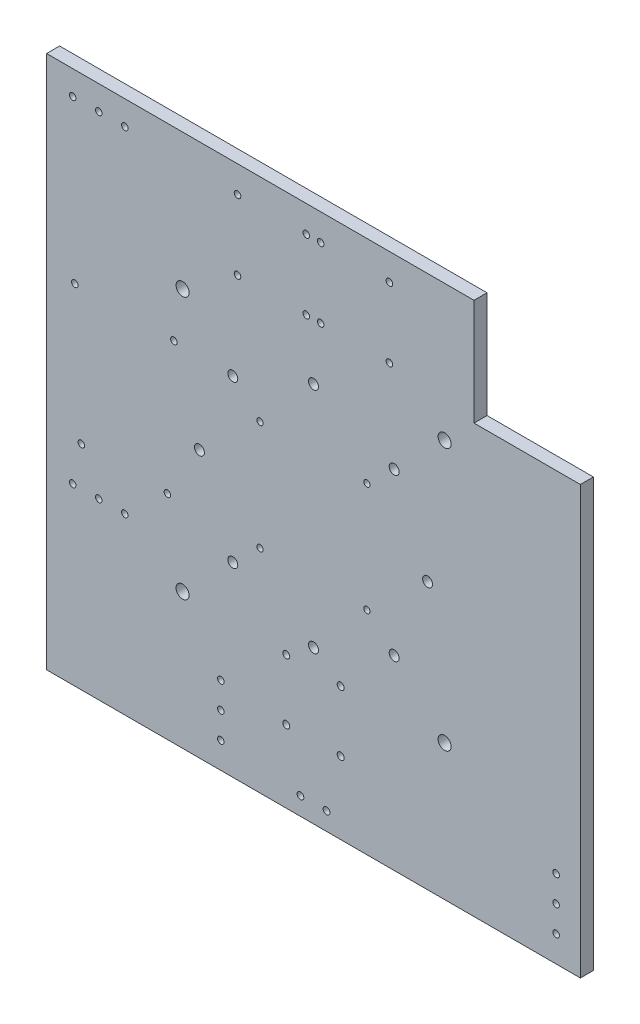
from build123d import *

# Parameters (mm, degrees)
SKETCH1_W           = 260
SKETCH1_H           = 260
SKETCH1_R           = 1.55
SKETCH1_R_2         = 1.5875
SKETCH1_R_3         = 1.6
SKETCH1_R_4         = 1.7
SKETCH1_R_5         = 2.415
SKETCH1_R_6         = 1.651
BOSS_EXTRUDE2_DEPTH = 6.35
SKETCH5_W           = 52.8
SKETCH5_H           = 52.8
CUT_EXTRUDE1_DEPTH  = 184.957393165
SKETCH6_R           = 3.175
CUT_EXTRUDE2_DEPTH  = 184.957393165
SKETCH7_R           = 1.5875
CUT_EXTRUDE3_DEPTH  = 184.957393165


with BuildPart() as part:
    # Sketch1 → Boss-Extrude2 (new body)
    with BuildSketch(Plane.XY):
        Rectangle(SKETCH1_W, SKETCH1_H)
        with Locations((-26.035, 26.67)):
            Circle(SKETCH1_R, mode=Mode.SUBTRACT)
        with Locations((-26.035, -26.67)):
            Circle(SKETCH1_R, mode=Mode.SUBTRACT)
        with Locations((26.035, 26.67)):
            Circle(SKETCH1_R, mode=Mode.SUBTRACT)
        with Locations((26.035, -26.67)):
            Circle(SKETCH1_R, mode=Mode.SUBTRACT)
        with Locations((-116.252739473, 39.816515681)):
            Circle(SKETCH1_R_2, mode=Mode.SUBTRACT)
        with Locations((-113.077739473, -26.221381917)):
            Circle(SKETCH1_R_2, mode=Mode.SUBTRACT)
        with Locations((-67.992739473, 39.818618083)):
            Circle(SKETCH1_R_2, mode=Mode.SUBTRACT)
        with Locations((-37, 117)):
            Circle(SKETCH1_R_3, mode=Mode.SUBTRACT)
        with Locations((-37, 83)):
            Circle(SKETCH1_R_3, mode=Mode.SUBTRACT)
        with Locations((-3.5, 117)):
            Circle(SKETCH1_R_3, mode=Mode.SUBTRACT)
        with Locations((-3.5, 83)):
            Circle(SKETCH1_R_3, mode=Mode.SUBTRACT)
        with Locations((3.5, 117)):
            Circle(SKETCH1_R_3, mode=Mode.SUBTRACT)
        with Locations((37, 117)):
            Circle(SKETCH1_R_3, mode=Mode.SUBTRACT)
        with Locations((37, 83)):
            Circle(SKETCH1_R_3, mode=Mode.SUBTRACT)
        with Locations((3.5, 83)):
            Circle(SKETCH1_R_3, mode=Mode.SUBTRACT)
        with Locations((-13.25, -65.25)):
            Circle(SKETCH1_R_4, mode=Mode.SUBTRACT)
        with Locations((13.25, -65.25)):
            Circle(SKETCH1_R_4, mode=Mode.SUBTRACT)
        with Locations((13.25, -94.75)):
            Circle(SKETCH1_R_4, mode=Mode.SUBTRACT)
        with Locations((-13.25, -94.75)):
            Circle(SKETCH1_R_4, mode=Mode.SUBTRACT)
        with Locations((0, 55.575)):
            Circle(SKETCH1_R_5, mode=Mode.SUBTRACT)
        with Locations((-55.575, 0)):
            Circle(SKETCH1_R_5, mode=Mode.SUBTRACT)
        with Locations((0, -55.575)):
            Circle(SKETCH1_R_5, mode=Mode.SUBTRACT)
        with Locations((55.575, 0)):
            Circle(SKETCH1_R_5, mode=Mode.SUBTRACT)
        with Locations((-39.297459364, 39.297459364)):
            Circle(SKETCH1_R_5, mode=Mode.SUBTRACT)
        with Locations((39.297459364, 39.297459364)):
            Circle(SKETCH1_R_5, mode=Mode.SUBTRACT)
        with Locations((39.297459364, -39.297459364)):
            Circle(SKETCH1_R_5, mode=Mode.SUBTRACT)
        with Locations((-39.297459364, -39.297459364)):
            Circle(SKETCH1_R_5, mode=Mode.SUBTRACT)
        with Locations((-71.167739473, -26.221381917)):
            Circle(SKETCH1_R_2, mode=Mode.SUBTRACT)
        with Locations((6.35, -121.3)):
            Circle(SKETCH1_R_6, mode=Mode.SUBTRACT)
        with Locations((-6.35, -121.3)):
            Circle(SKETCH1_R_6, mode=Mode.SUBTRACT)
        with Locations((121.3, 126.35)):
            Circle(SKETCH1_R_6, mode=Mode.SUBTRACT)
        with Locations((121.3, 113.65)):
            Circle(SKETCH1_R_6, mode=Mode.SUBTRACT)
    extrude(amount=BOSS_EXTRUDE2_DEPTH)

    # Sketch5 → Cut-Extrude1 (cut, through all)
    with BuildSketch(Plane(origin=(0, 0, 0), x_dir=(-1, 0, 0), z_dir=(0, 0, -1))):
        with Locations((-104.6, 104.6)):
            Rectangle(SKETCH5_W, SKETCH5_H)
    extrude(amount=-CUT_EXTRUDE1_DEPTH, mode=Mode.SUBTRACT)

    # Sketch6 → Cut-Extrude2 (cut, through all)
    with BuildSketch(Plane(origin=(0, 0, 0), x_dir=(-1, 0, 0), z_dir=(0, 0, -1))):
        with Locations((63.77864005, 63.77864005)):
            Circle(SKETCH6_R)
        with Locations((-63.87464005, 63.77864005)):
            Circle(SKETCH6_R)
        with Locations((-63.87464005, -63.87464005)):
            Circle(SKETCH6_R)
        with Locations((63.77864005, -63.87464005)):
            Circle(SKETCH6_R)
    extrude(amount=-CUT_EXTRUDE2_DEPTH, mode=Mode.SUBTRACT)

    # Sketch7 → Cut-Extrude3 (cut, through all)
    with BuildSketch(Plane(origin=(0, 0, 0), x_dir=(-1, 0, 0), z_dir=(0, 0, -1))):
        with Locations((91.9, 118.189)):
            Circle(SKETCH7_R)
        with Locations((104.6, 118.189)):
            Circle(SKETCH7_R)
        with Locations((117.3, 118.189)):
            Circle(SKETCH7_R)
        with Locations((91.9, -45.133)):
            Circle(SKETCH7_R)
        with Locations((104.6, -45.133)):
            Circle(SKETCH7_R)
        with Locations((117.3, -45.133)):
            Circle(SKETCH7_R)
        with Locations((45.133, -117.3)):
            Circle(SKETCH7_R)
        with Locations((45.133, -104.6)):
            Circle(SKETCH7_R)
        with Locations((45.133, -91.9)):
            Circle(SKETCH7_R)
        with Locations((-118.189, -117.3)):
            Circle(SKETCH7_R)
        with Locations((-118.189, -104.6)):
            Circle(SKETCH7_R)
        with Locations((-118.189, -91.9)):
            Circle(SKETCH7_R)
    extrude(amount=-CUT_EXTRUDE3_DEPTH, mode=Mode.SUBTRACT)


solid = part.part
